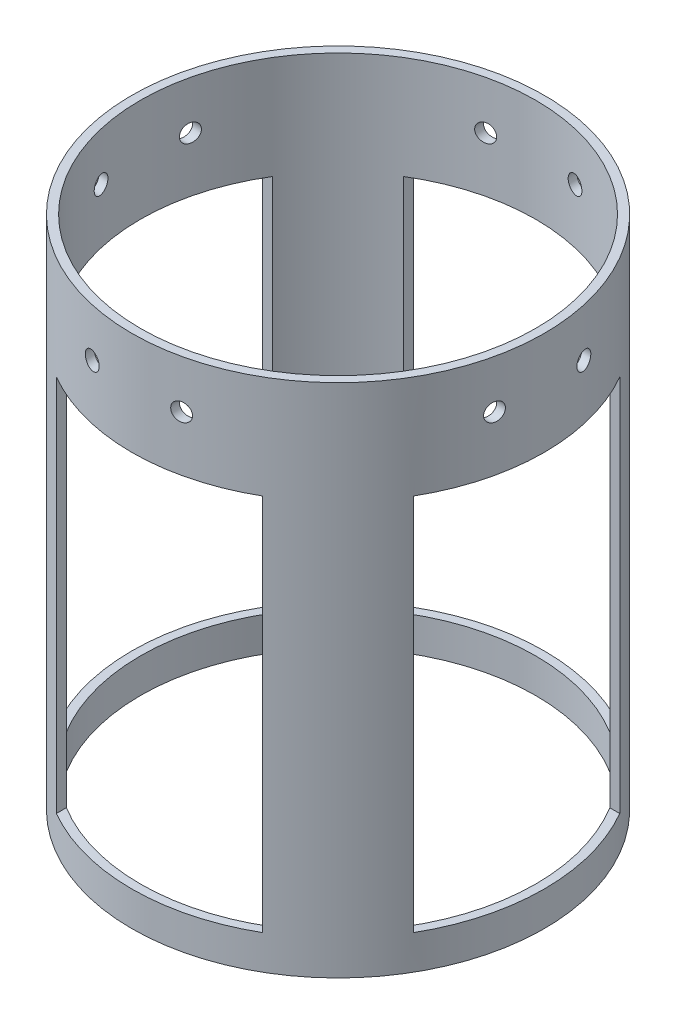
from build123d import *

# Parameters (mm, degrees)
SKETCH1_R           = 76.2
SKETCH1_R_2         = 73.025
BOSS_EXTRUDE1_DEPTH = 190.5
SKETCH6_W           = 76.2
SKETCH6_H           = 139.7
CUT_EXTRUDE6_DEPTH  = 20.574
CIRPATTERN9_COUNT   = 4
SKETCH7_R           = 3.302
CUT_EXTRUDE7_DEPTH  = 17.78
CIRPATTERN10_COUNT  = 4


with BuildPart() as part:
    # Sketch1 → Boss-Extrude1 (new body)
    with BuildSketch(Plane(origin=(0, 0, 0), x_dir=(1, 0, 0), z_dir=(0, 1, 0))):
        Circle(SKETCH1_R)
        Circle(SKETCH1_R_2, mode=Mode.SUBTRACT)
    extrude(amount=BOSS_EXTRUDE1_DEPTH)

    # Sketch6 → Cut-Extrude6 (cut)
    with BuildSketch(Plane(origin=(0, 0, -76.2), x_dir=(-1, 0, 0), z_dir=(0, 0, -1))):
        with Locations((0, 82.55)):
            Rectangle(SKETCH6_W, SKETCH6_H)
    cut_extrude6 = extrude(amount=-CUT_EXTRUDE6_DEPTH, mode=Mode.SUBTRACT)

    # CirPattern9: Cut-Extrude6 ×4 about axis
    cirpattern9_axis = Axis((0, 0, 0), (0, 1, 0))
    for i in range(1, CIRPATTERN9_COUNT):
        add(cut_extrude6.rotate(cirpattern9_axis, i * 360 / CIRPATTERN9_COUNT), mode=Mode.SUBTRACT)

    # Sketch7 → Cut-Extrude7 (cut)
    with BuildSketch(Plane(origin=(0, 0, -76.2), x_dir=(-1, 0, 0), z_dir=(0, 0, -1))):
        with Locations((-16.51, 172.72)):
            Circle(SKETCH7_R)
        with Locations((16.51, 172.72)):
            Circle(SKETCH7_R)
    cut_extrude7 = extrude(amount=-CUT_EXTRUDE7_DEPTH, mode=Mode.SUBTRACT)

    # CirPattern10: Cut-Extrude7 ×4 about axis
    cirpattern10_axis = Axis((0, 190.5, 0), (0, 1, 0))
    for i in range(1, CIRPATTERN10_COUNT):
        add(cut_extrude7.rotate(cirpattern10_axis, i * 360 / CIRPATTERN10_COUNT), mode=Mode.SUBTRACT)


solid = part.part
